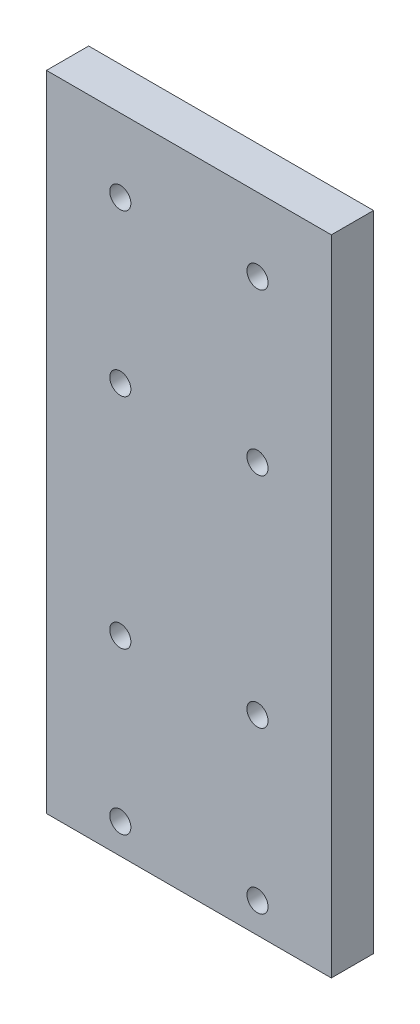
from build123d import *

# Parameters (mm, degrees)
SKETCH1_W           = 54
SKETCH1_H           = 122
SKETCH1_R           = 2
BOSS_EXTRUDE1_DEPTH = 8


with BuildPart() as part:
    # Sketch1 → Boss-Extrude1 (new body)
    with BuildSketch(Plane.XY):
        Rectangle(SKETCH1_W, SKETCH1_H)
        with Locations((-13, 47.14)):
            Circle(SKETCH1_R, mode=Mode.SUBTRACT)
        with Locations((13, 47.14)):
            Circle(SKETCH1_R, mode=Mode.SUBTRACT)
        with Locations((13, 16.64)):
            Circle(SKETCH1_R, mode=Mode.SUBTRACT)
        with Locations((-13, 16.64)):
            Circle(SKETCH1_R, mode=Mode.SUBTRACT)
        with Locations((13, -24.8)):
            Circle(SKETCH1_R, mode=Mode.SUBTRACT)
        with Locations((-13, -24.8)):
            Circle(SKETCH1_R, mode=Mode.SUBTRACT)
        with Locations((-13, -55.3)):
            Circle(SKETCH1_R, mode=Mode.SUBTRACT)
        with Locations((13, -55.3)):
            Circle(SKETCH1_R, mode=Mode.SUBTRACT)
    extrude(amount=BOSS_EXTRUDE1_DEPTH)


solid = part.part
